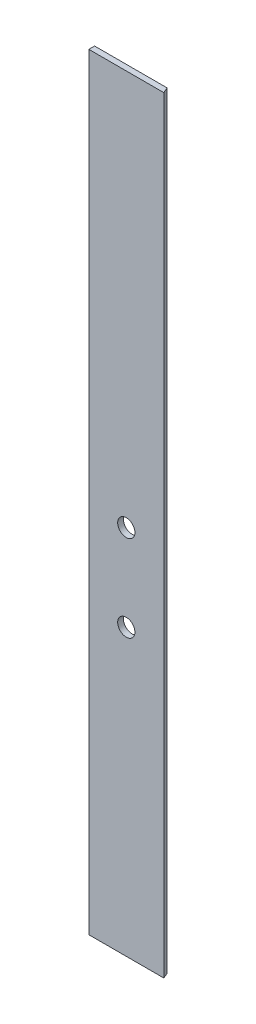
from build123d import *

# Parameters (mm, degrees)
EXTRUDE_1_DEPTH    = 533.2
SKETCH1_R          = 6
CUT_EXTRUDE1_DEPTH = 536.754562943


with BuildPart() as part:
    # Эскиз1 → Вытянуть1 (new body)
    with BuildSketch(Plane(origin=(0, 0, 0), x_dir=(1, 0, 0), z_dir=(0, 1, 0))):
        Polygon((0, -1), (50.485205308, -1), (52.102895451, -5), (0, -5), align=None)
    extrude(amount=EXTRUDE_1_DEPTH)

    # Sketch1 → Cut-Extrude1 (cut, through all)
    with BuildSketch(Plane.XY.offset(5)):
        with Locations((26.051447726, 258.2)):
            Circle(SKETCH1_R)
        with Locations((26.051447726, 198.2)):
            Circle(SKETCH1_R)
    extrude(amount=-CUT_EXTRUDE1_DEPTH, mode=Mode.SUBTRACT)


solid = part.part
